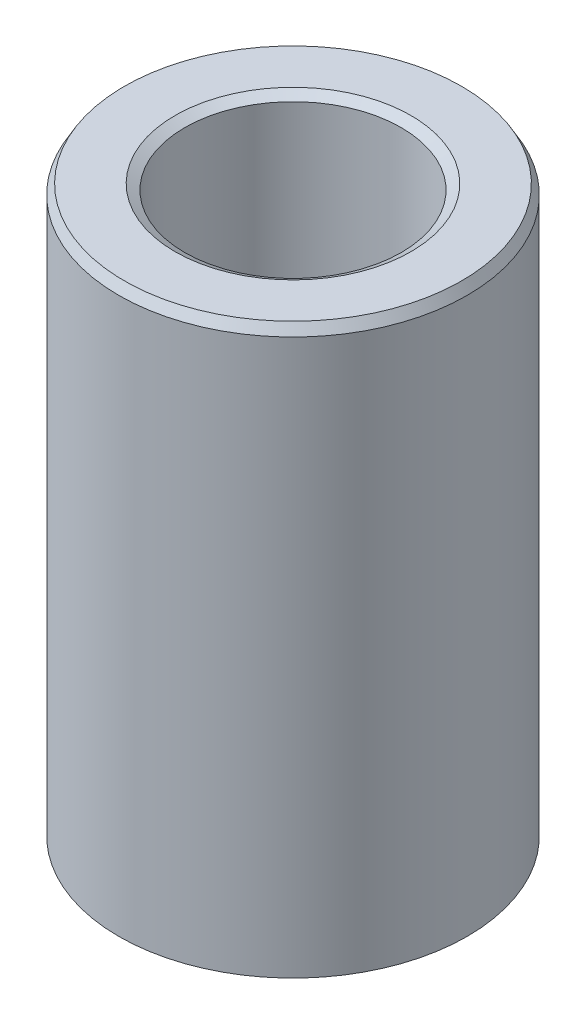
from build123d import *
from OCP.BRepFilletAPI import BRepFilletAPI_MakeChamfer

# Parameters (mm, degrees)
SKETCH1_R           = 22.5
BOSS_EXTRUDE1_DEPTH = 73.685954137
SKETCH2_R           = 13.981644235
CUT_EXTRUDE1_DEPTH  = 81.262817276
CHAMFER1_SIZE       = 1.255876777
CHAMFER1_SIZE2      = 0.725080795


with BuildPart() as part:
    # Sketch1 → Boss-Extrude1 (new body)
    with BuildSketch(Plane(origin=(0, 0, 0), x_dir=(1, 0, 0), z_dir=(0, 1, 0))):
        Circle(SKETCH1_R)
    extrude(amount=BOSS_EXTRUDE1_DEPTH)

    # Sketch2 → Cut-Extrude1 (cut, through all)
    with BuildSketch(Plane(origin=(0, 0, 0), x_dir=(1, 0, 0), z_dir=(0, 1, 0))):
        Circle(SKETCH2_R)
    extrude(amount=CUT_EXTRUDE1_DEPTH, mode=Mode.SUBTRACT)

    # Chamfer1: one chamfer whose edges measure the first distance from different faces: ONE call of the kernel's chamfer builder (chamfer() names one face for all edges)
    chamfer1_edges_1 = [part.edges().sort_by_distance(p)[0] for p in [
        (-13.981644235, 73.685954137, 0),
    ]]
    chamfer1_side_1 = [part.faces().sort_by_distance(p)[0] for p in [
        (-21.863603897, 73.685954137, 0),
    ]]
    chamfer1_edges_2 = [part.edges().sort_by_distance(p)[0] for p in [
        (-13.981644235, 0, 0),
    ]]
    chamfer1_side_2 = [part.faces().sort_by_distance(p)[0] for p in [
        (-13.981644235, 36.842977069, 0),
    ]]
    chamfer1_edges_3 = [part.edges().sort_by_distance(p)[0] for p in [
        (-22.5, 0, 0),
    ]]
    chamfer1_side_3 = [part.faces().sort_by_distance(p)[0] for p in [
        (-21.863603897, 0, 0),
    ]]
    chamfer1_edges_4 = [part.edges().sort_by_distance(p)[0] for p in [
        (-22.5, 73.685954137, 0),
    ]]
    chamfer1_side_4 = [part.faces().sort_by_distance(p)[0] for p in [
        (-22.5, 36.842977069, 0),
    ]]
    chamfer1 = BRepFilletAPI_MakeChamfer(part.part.solid().wrapped)
    for e in chamfer1_edges_1:
        chamfer1.Add(CHAMFER1_SIZE, CHAMFER1_SIZE2, e.wrapped, chamfer1_side_1[0].wrapped)  # the first distance lies on this face
    for e in chamfer1_edges_2:
        chamfer1.Add(CHAMFER1_SIZE, CHAMFER1_SIZE2, e.wrapped, chamfer1_side_2[0].wrapped)  # the first distance lies on this face
    for e in chamfer1_edges_3:
        chamfer1.Add(CHAMFER1_SIZE, CHAMFER1_SIZE2, e.wrapped, chamfer1_side_3[0].wrapped)  # the first distance lies on this face
    for e in chamfer1_edges_4:
        chamfer1.Add(CHAMFER1_SIZE, CHAMFER1_SIZE2, e.wrapped, chamfer1_side_4[0].wrapped)  # the first distance lies on this face
    add(Compound.cast(chamfer1.Shape()), mode=Mode.REPLACE)


solid = part.part
